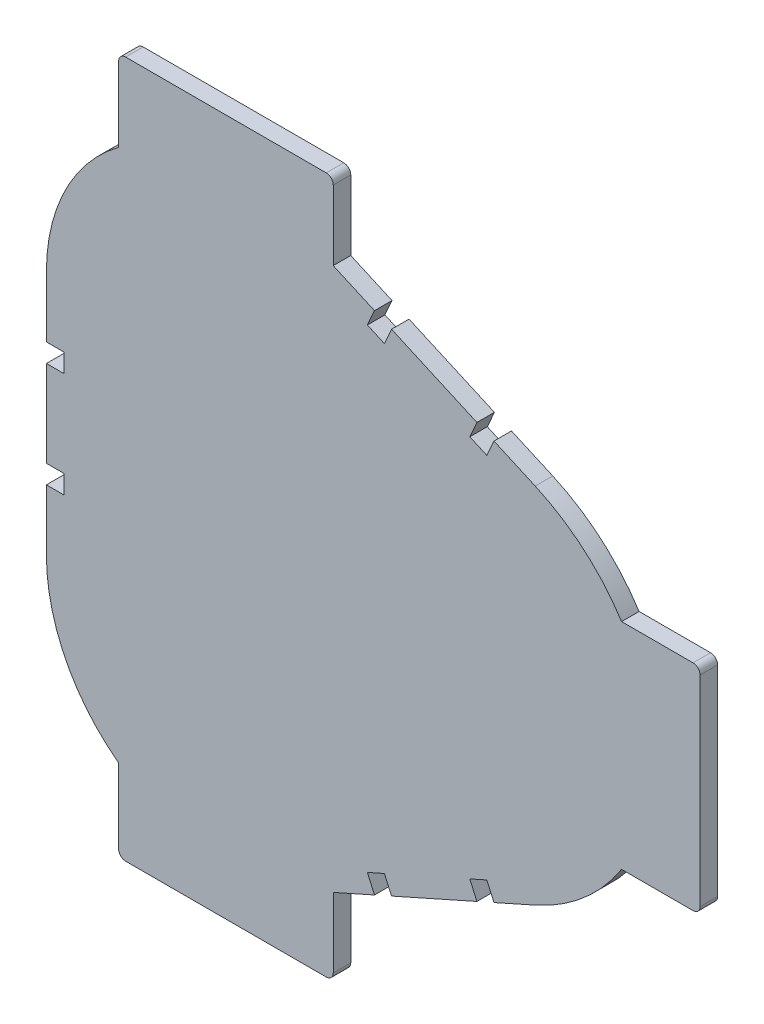
from build123d import *

# Parameters (mm, degrees)
BOSS_EXTRUDE1_DEPTH = 6.35


with BuildPart() as part:
    # Sketch1 → Boss-Extrude1 (new body)
    with BuildSketch(Plane(origin=(0, 0, -130.81), x_dir=(-1, 0, 0), z_dir=(0, 0, -1))):
        with BuildLine():
            Line((83.226798569, 59.314378099), (83.226798569, 81.336178099))
            ThreePointArc((83.226798569, 81.336178099), (76.310939467, 110.532802074), (57.033048569, 133.52486334))
            Line((57.033048569, 133.52486334), (57.033048569, 160.569312576))
            ThreePointArc((57.033048569, 160.569312576), (56.289099793, 162.3653638), (54.493048569, 163.109312576))
            Line((54.493048569, 163.109312576), (-18.214451431, 163.109312576))
            ThreePointArc((-18.214451431, 163.109312576), (-20.010502655, 162.3653638), (-20.754451431, 160.569312576))
            Line((-20.754451431, 160.569312576), (-20.754451431, 135.265698217))
            Line((-20.754451431, 135.265698217), (-35.707221998, 128.607085142))
            Line((-35.707221998, 128.607085142), (-33.124052341, 122.80624602))
            Line((-33.124052341, 122.80624602), (-39.296145167, 120.057753504))
            Line((-39.296145167, 120.057753504), (-41.879314824, 125.858592626))
            Line((-41.879314824, 125.858592626), (-72.83259238, 112.074799335))
            Line((-72.83259238, 112.074799335), (-70.249422723, 106.273960213))
            Line((-70.249422723, 106.273960213), (-76.421515549, 103.525467697))
            Line((-76.421515549, 103.525467697), (-79.004685206, 109.326306819))
            Line((-79.004685206, 109.326306819), (-93.957455774, 102.667693744))
            ThreePointArc((-93.957455774, 102.667693744), (-111.579245978, 91.514788164), (-125.266063418, 75.779928099))
            Line((-125.266063418, 75.779928099), (-151.18728746, 75.779928099))
            ThreePointArc((-151.18728746, 75.779928099), (-152.983338684, 75.035979323), (-153.72728746, 73.239928099))
            Line((-153.72728746, 73.239928099), (-153.72728746, 0.532428099))
            ThreePointArc((-153.72728746, 0.532428099), (-152.983338684, -1.263623125), (-151.18728746, -2.007571901))
            Line((-151.18728746, -2.007571901), (-125.266063418, -2.007571901))
            ThreePointArc((-125.266063418, -2.007571901), (-111.579245978, -17.742431966), (-93.957455774, -28.895337546))
            Line((-93.957455774, -28.895337546), (-79.004685206, -35.553950621))
            Line((-79.004685206, -35.553950621), (-76.421515549, -29.753111499))
            Line((-76.421515549, -29.753111499), (-70.249422723, -32.501604014))
            Line((-70.249422723, -32.501604014), (-72.83259238, -38.302443137))
            Line((-72.83259238, -38.302443137), (-41.879314824, -52.086236428))
            Line((-41.879314824, -52.086236428), (-39.296145167, -46.285397306))
            Line((-39.296145167, -46.285397306), (-33.124052341, -49.033889822))
            Line((-33.124052341, -49.033889822), (-35.707221998, -54.834728944))
            Line((-35.707221998, -54.834728944), (-20.754451431, -61.493342019))
            Line((-20.754451431, -61.493342019), (-20.754451431, -86.796956378))
            ThreePointArc((-20.754451431, -86.796956378), (-20.010502655, -88.593007602), (-18.214451431, -89.336956378))
            Line((-18.214451431, -89.336956378), (54.493048569, -89.336956378))
            ThreePointArc((54.493048569, -89.336956378), (56.289099793, -88.593007602), (57.033048569, -86.796956378))
            Line((57.033048569, -86.796956378), (57.033048569, -59.752507142))
            ThreePointArc((57.033048569, -59.752507142), (76.310939467, -36.760445876), (83.226798569, -7.563821901))
            Line((83.226798569, -7.563821901), (83.226798569, 14.457978099))
            Line((83.226798569, 14.457978099), (76.876798569, 14.457978099))
            Line((76.876798569, 14.457978099), (76.876798569, 21.214378099))
            Line((76.876798569, 21.214378099), (83.226798569, 21.214378099))
            Line((83.226798569, 21.214378099), (83.226798569, 52.557978099))
            Line((83.226798569, 52.557978099), (76.876798569, 52.557978099))
            Line((76.876798569, 52.557978099), (76.876798569, 59.314378099))
            Line((76.876798569, 59.314378099), (83.226798569, 59.314378099))
        make_face()
    extrude(amount=BOSS_EXTRUDE1_DEPTH)


solid = part.part
